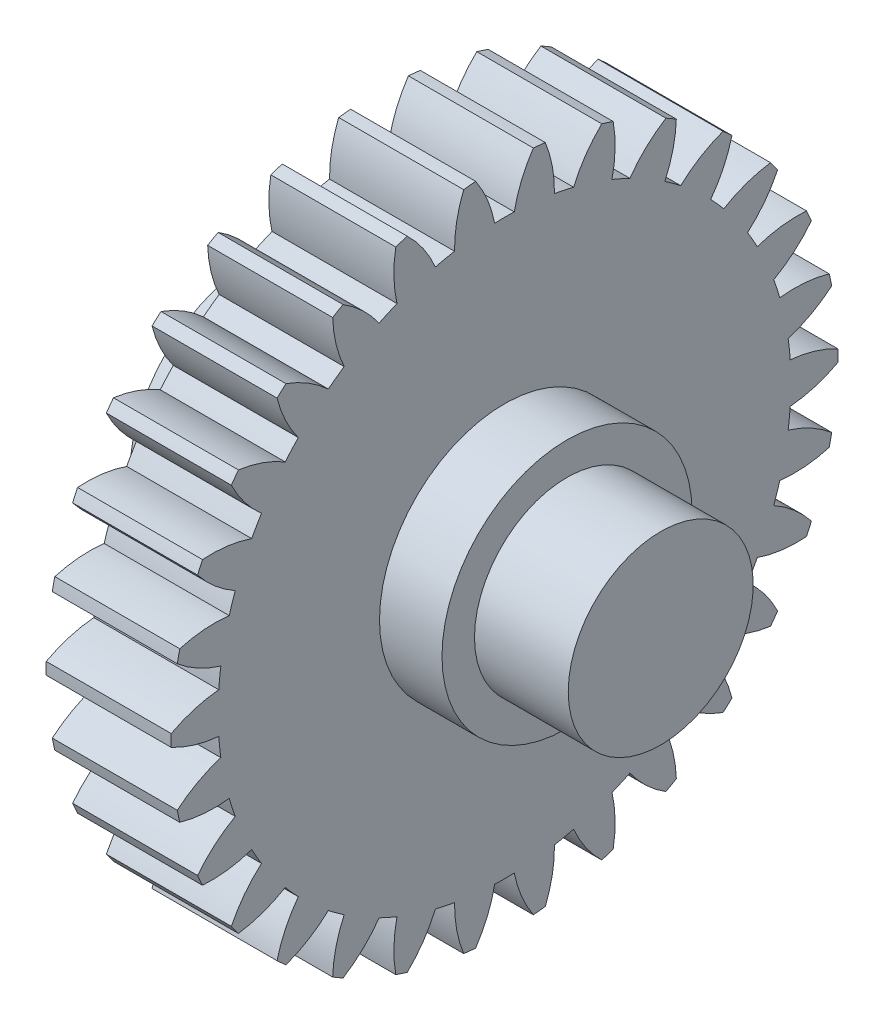
from build123d import *

# Parameters (mm, degrees)
BASPROSKE_W         = 12.7
BASPROSKE_H         = 33.866666667
TOOTHCUT_DEPTH      = 50.549896289
TEETHCUTS_COUNT     = 30
TEETHCUTS_ANGLE     = 348
SKETCH1_R           = 12.7
SKETCH1_R_2         = 4.953
BOSS_EXTRUDE2_DEPTH = 12.7
SKETCH3_R           = 3.302
CUT_EXTRUDE1_DEPTH  = 50.463042002
CUT_EXTRUDE2_DEPTH  = 8.255
BOSS_EXTRUDE3_START = 6.35
SKETCH5_R           = 12.7
BOSS_EXTRUDE3_DEPTH = 6.35
SKETCH6_R           = 9.398
BOSS_EXTRUDE4_DEPTH = 9.525


with BuildPart() as part:
    # BasProSke → Base-Revolve (revolve)
    with BuildSketch(Plane(origin=(0, 0, 0), x_dir=(1, 0, 0), z_dir=(0, 1, 0))):
        with Locations((6.35, 16.933333334)):
            Rectangle(BASPROSKE_W, BASPROSKE_H)
    revolve(axis=Axis((-10, 0, 0), (1, 0, 0)))

    # TooCutSke → ToothCut (cut, through all)
    with BuildSketch(Plane(origin=(0, 0, 0), x_dir=(0, 0, -1), z_dir=(1, 0, 0))):
        with BuildLine():
            ThreePointArc((0.995262134, 29.085873679), (0, 29.102896667), (-0.995262134, 29.085873679))
            ThreePointArc((-0.995262134, 29.085873679), (-1.736289099, 31.523168017), (-2.948832865, 33.763539028))
            ThreePointArc((-2.948832865, 33.763539028), (0, 33.892066667), (2.948832865, 33.763539028))
            ThreePointArc((2.948832865, 33.763539028), (1.736289099, 31.523168017), (0.995262134, 29.085873679))
        make_face()
    toothcut = extrude(amount=TOOTHCUT_DEPTH, mode=Mode.SUBTRACT)

    # TeethCuts: ToothCut ×30 about axis
    teethcuts_axis = Axis((-10, 0, 0), (1, 0, 0))
    for i in range(1, TEETHCUTS_COUNT):
        add(toothcut.rotate(teethcuts_axis, i * TEETHCUTS_ANGLE / (TEETHCUTS_COUNT - 1)), mode=Mode.SUBTRACT)

    # Sketch1 → Boss-Extrude2 (add)
    with BuildSketch(Plane.ZY):
        Circle(SKETCH1_R)
        Circle(SKETCH1_R_2, mode=Mode.SUBTRACT)
    extrude(amount=BOSS_EXTRUDE2_DEPTH)

    # Sketch3 → Cut-Extrude1 (cut, through all)
    with BuildSketch(Plane(origin=(0, 0, 0), x_dir=(1, 0, 0), z_dir=(0, 1, 0))):
        with Locations((-6.35, 0)):
            Circle(SKETCH3_R)
    extrude(amount=CUT_EXTRUDE1_DEPTH, mode=Mode.SUBTRACT)

    # Sketch4 → Cut-Extrude2 (cut)
    with BuildSketch(Plane(origin=(0, 0, 0), x_dir=(1, 0, 0), z_dir=(0, 1, 0))):
        Polygon((-3.527045859, 4.8895), (-9.172954141, 4.8895), (-11.995908282, 0), (-9.172954141, -4.8895), (-3.527045859, -4.8895), (-0.704091718, 0), align=None)
    extrude(amount=CUT_EXTRUDE2_DEPTH, mode=Mode.SUBTRACT)

    # Sketch5 → Boss-Extrude3 (add)
    with BuildSketch(Plane(origin=(12.7, 0, 0), x_dir=(0, 0, -1), z_dir=(1, 0, 0)).offset(BOSS_EXTRUDE3_START)):
        Circle(SKETCH5_R)
    extrude(amount=-BOSS_EXTRUDE3_DEPTH)

    # Sketch6 → Boss-Extrude4 (add)
    with BuildSketch(Plane(origin=(19.05, 0, 0), x_dir=(0, 0, -1), z_dir=(1, 0, 0))):
        Circle(SKETCH6_R)
    extrude(amount=BOSS_EXTRUDE4_DEPTH)


solid = part.part
